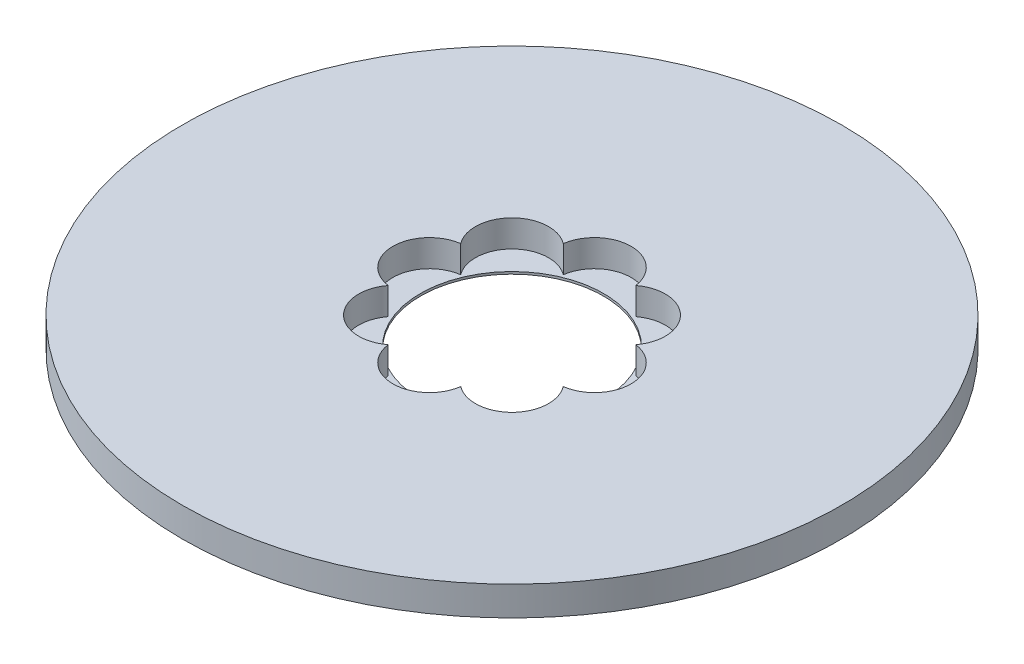
from build123d import *

# Parameters (mm, degrees)
SKETCH1_R           = 90
BOSS_EXTRUDE1_DEPTH = 8
SKETCH2_R           = 25
CUT_EXTRUDE1_DEPTH  = 128.530388535
SKETCH3_R           = 10
CUT_EXTRUDE2_DEPTH  = 7.368924417
CIRPATTERN1_COUNT   = 8


with BuildPart() as part:
    # Sketch1 → Boss-Extrude1 (new body)
    with BuildSketch(Plane(origin=(0, 0, 0), x_dir=(1, 0, 0), z_dir=(0, 1, 0))):
        Circle(SKETCH1_R)
    extrude(amount=BOSS_EXTRUDE1_DEPTH)

    # Sketch2 → Cut-Extrude1 (cut, through all)
    with BuildSketch(Plane(origin=(0, 0, 0), x_dir=(1, 0, 0), z_dir=(0, 1, 0))):
        Circle(SKETCH2_R)
    extrude(amount=CUT_EXTRUDE1_DEPTH, mode=Mode.SUBTRACT)

    # Sketch3 → Cut-Extrude2 (cut)
    with BuildSketch(Plane(origin=(0, 8, 0), x_dir=(1, 0, 0), z_dir=(0, 1, 0))):
        with Locations((-22.534424719, 0)):
            Circle(SKETCH3_R)
    cut_extrude2 = extrude(amount=-CUT_EXTRUDE2_DEPTH, mode=Mode.SUBTRACT)

    # CirPattern1: Cut-Extrude2 ×8 about axis
    cirpattern1_axis = Axis((0, 0, 0), (0, 1, 0))
    for i in range(1, CIRPATTERN1_COUNT):
        add(cut_extrude2.rotate(cirpattern1_axis, i * 360 / CIRPATTERN1_COUNT), mode=Mode.SUBTRACT)


solid = part.part
